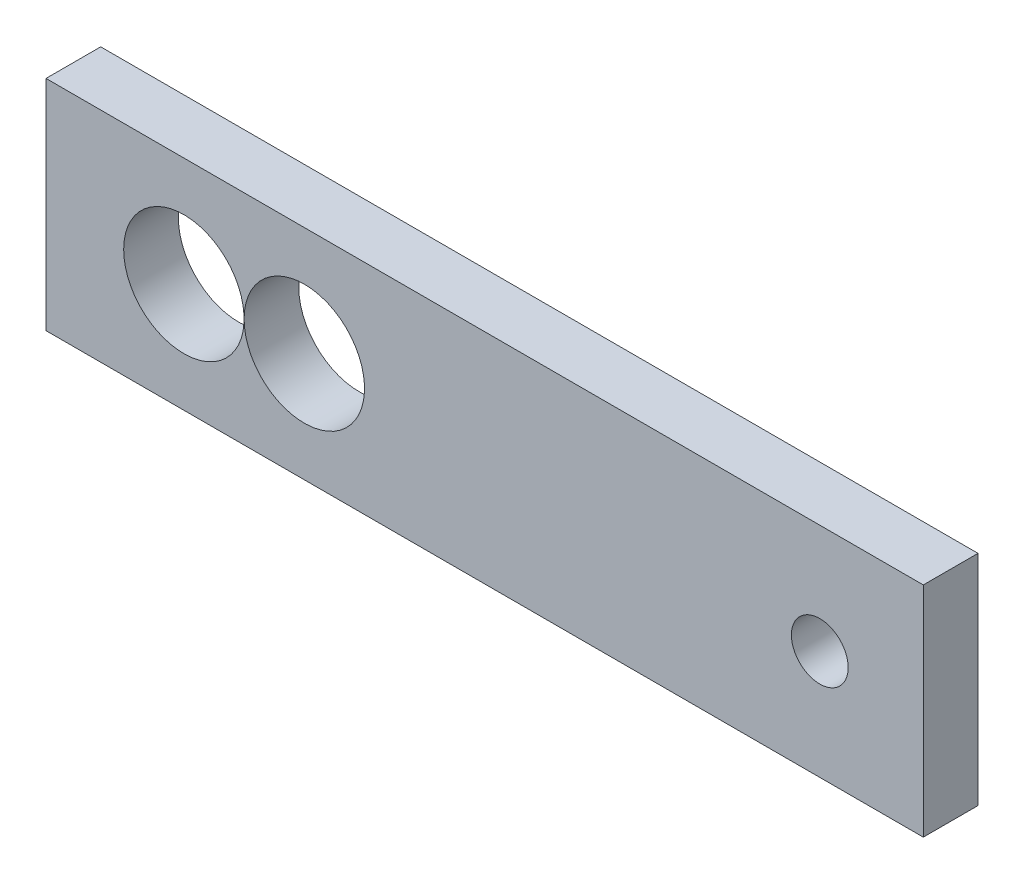
from build123d import *

# Parameters (mm, degrees)
ESBO_O1_W             = 51
ESBO_O1_H             = 12.7
FLANGE_BASE1_DEPTH    = 3.18
ESBO_O2_R             = 3.5
ESBO_O2_R_2           = 1.65
CORTE_EXTRUS_O1_DEPTH = 10


# Sheet-metal steps are written as plain solids
with BuildPart() as part:
    # Esboço1 → Flange-base1 (new body)
    with BuildSketch(Plane.XY):
        Rectangle(ESBO_O1_W, ESBO_O1_H)
    extrude(amount=-FLANGE_BASE1_DEPTH)

    # Esboço2 → Corte-extrusão1 (cut)
    with BuildSketch(Plane(origin=(0, 0, -3.18), x_dir=(-1, 0, 0), z_dir=(0, 0, -1))):
        with Locations((17.485, 0)):
            Circle(ESBO_O2_R)
        with Locations((-19.4825, 0)):
            Circle(ESBO_O2_R_2)
        with Locations((10.484, 0)):
            Circle(ESBO_O2_R)
    extrude(amount=-CORTE_EXTRUS_O1_DEPTH, mode=Mode.SUBTRACT)


solid = part.part
